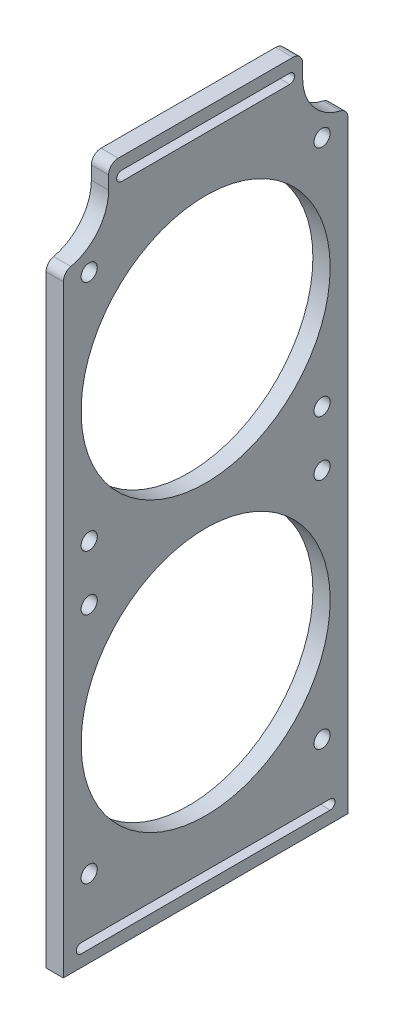
from build123d import *

# Parameters (mm, degrees)
SKETCH2_R                 = 38.5
SKETCH2_W                 = 4
SKETCH2_H                 = 189.008661332
BOSS_EXTRUDE2_DEPTH       = 5.334
F_3_0MM_DOWEL_SLOT1_DEPTH = 5.334
F_3_0MM_DOWEL_SLOT2_DEPTH = 5.334
FILLET1_R                 = 15
FILLET2_R                 = 3
F_5_0MM_DOWEL_HOLE1_D     = 5


# Read off the part's stored shape, not the designer's step: Ø3.0mm Dowel Slot1, Ø3.0mm Dowel Slot2
with BuildPart() as part:
    # Sketch2 → Boss-Extrude2 (new body)
    # profile 1 of 3: a face of its own
    with BuildSketch(Plane(origin=(0, 0, 0), x_dir=(0, 0, -1), z_dir=(1, 0, 0))):
        Polygon((28.490859753, 116.416616863), (28.490859753, 94.390736923), (38.490859753, 94.390736923), (38.490859753, -94.617924409), (-41.509140247, -94.617924409), (-41.509140247, 94.390736923), (-31.509140247, 94.390736923), (-31.509140247, 116.416616863), align=None)
        with Locations((-1.509140247, 54.390736923)):
            Circle(SKETCH2_R, mode=Mode.SUBTRACT)
        with Locations((-1.509140247, -34.676182382)):
            Circle(SKETCH2_R, mode=Mode.SUBTRACT)
    # profile 2 of 3: a face of its own
    with BuildSketch(Plane(origin=(0, 0, 0), x_dir=(0, 0, -1), z_dir=(1, 0, 0))):
        with Locations((-43.509140247, -0.113593743)):
            Rectangle(SKETCH2_W, SKETCH2_H)
    # profile 3 of 3: a face of its own
    with BuildSketch(Plane(origin=(0, 0, 0), x_dir=(0, 0, -1), z_dir=(1, 0, 0))):
        with Locations((40.490859753, -0.113593743)):
            Rectangle(SKETCH2_W, SKETCH2_H)
    extrude(amount=BOSS_EXTRUDE2_DEPTH)

    # Ø3.0mm Dowel Slot1 outline → Ø3.0mm Dowel Slot1 (cut)
    with BuildSketch(Plane.YZ):
        with BuildLine():
            ThreePointArc((-87.91563933, 39.992900247), (-89.41563933, 41.492900247), (-90.91563933, 39.992900247))
            Line((-90.91563933, 39.992900247), (-90.91563933, -37.007099753))
            ThreePointArc((-90.91563933, -37.007099753), (-89.41563933, -38.507099753), (-87.91563933, -37.007099753))
            Line((-87.91563933, -37.007099753), (-87.91563933, 39.992900247))
        make_face()
    extrude(amount=F_3_0MM_DOWEL_SLOT1_DEPTH, mode=Mode.SUBTRACT)

    # Ø3.0mm Dowel Slot2 outline → Ø3.0mm Dowel Slot2 (cut)
    with BuildSketch(Plane.YZ):
        with BuildLine():
            ThreePointArc((112.653676893, 27.509140247), (111.153676893, 29.009140247), (109.653676893, 27.509140247))
            Line((109.653676893, 27.509140247), (109.653676893, -24.490859753))
            ThreePointArc((109.653676893, -24.490859753), (111.153676893, -25.990859753), (112.653676893, -24.490859753))
            Line((112.653676893, -24.490859753), (112.653676893, 27.509140247))
        make_face()
    extrude(amount=F_3_0MM_DOWEL_SLOT2_DEPTH, mode=Mode.SUBTRACT)

    # Fillet1
    # the kernel refuses this fillet: 15 mm, written as the material it adds along each edge
    with BuildSketch(Plane(origin=(0, 94.390736923, 31.509140247), x_dir=(0, 1, 0), z_dir=(1, 0, 0))) as fillet1_piece_1:
        with BuildLine():
            CenterArc((14.966629547, 15), FILLET1_R, 183.822553729, 86.177446271)
            Line((0, 14), (-0.299332591, 13.98))
            ThreePointArc((-0.299332591, 13.98), (-0.3, 7), (-0.3, 0))
            Line((-0.3, 0), (0, -0.3))
            Line((0, -0.3), (14.966629547, -0.3))
            Line((14.966629547, -0.3), (14.966629547, 0))
        make_face()
    extrude(amount=5.334)
    with BuildSketch(Plane(origin=(0, 94.390736923, -28.490859753), x_dir=(0, 1, 0), z_dir=(1, 0, 0))) as fillet1_piece_2:
        with BuildLine():
            CenterArc((14.966629547, -15), FILLET1_R, 90, 86.177446271)
            Line((0, -14), (-0.299332591, -13.98))
            ThreePointArc((-0.299332591, -13.98), (-0.3, -7), (-0.3, 0))
            Line((-0.3, 0), (0, 0.3))
            Line((0, 0.3), (14.966629547, 0.3))
            Line((14.966629547, 0.3), (14.966629547, 0))
        make_face()
    extrude(amount=5.334)

    # Fillet2
    fillet2_edges = [part.edges().sort_by_distance(p)[0] for p in [
        (2.667, 94.390736923, -42.490859753),
        (2.667, 94.390736923, 45.509140247),
        (2.667, 116.416616863, 31.509140247),
        (2.667, 116.416616863, -28.490859753),
    ]]
    fillet(fillet2_edges, radius=FILLET2_R)

    # Ø5.0mm Dowel Hole1 (through all)
    with Locations(Plane.ZY):
        with Locations((-34.490859753, 90.390736923), (37.509140247, 90.390736923), (-34.490859753, 18.390736923), (37.509140247, 18.390736923), (37.509140247, 1.323817618), (-34.490859753, 1.323817618), (-34.490859753, -70.676182382), (37.509140247, -70.676182382)):
            Hole(F_5_0MM_DOWEL_HOLE1_D / 2)


solid = part.part
